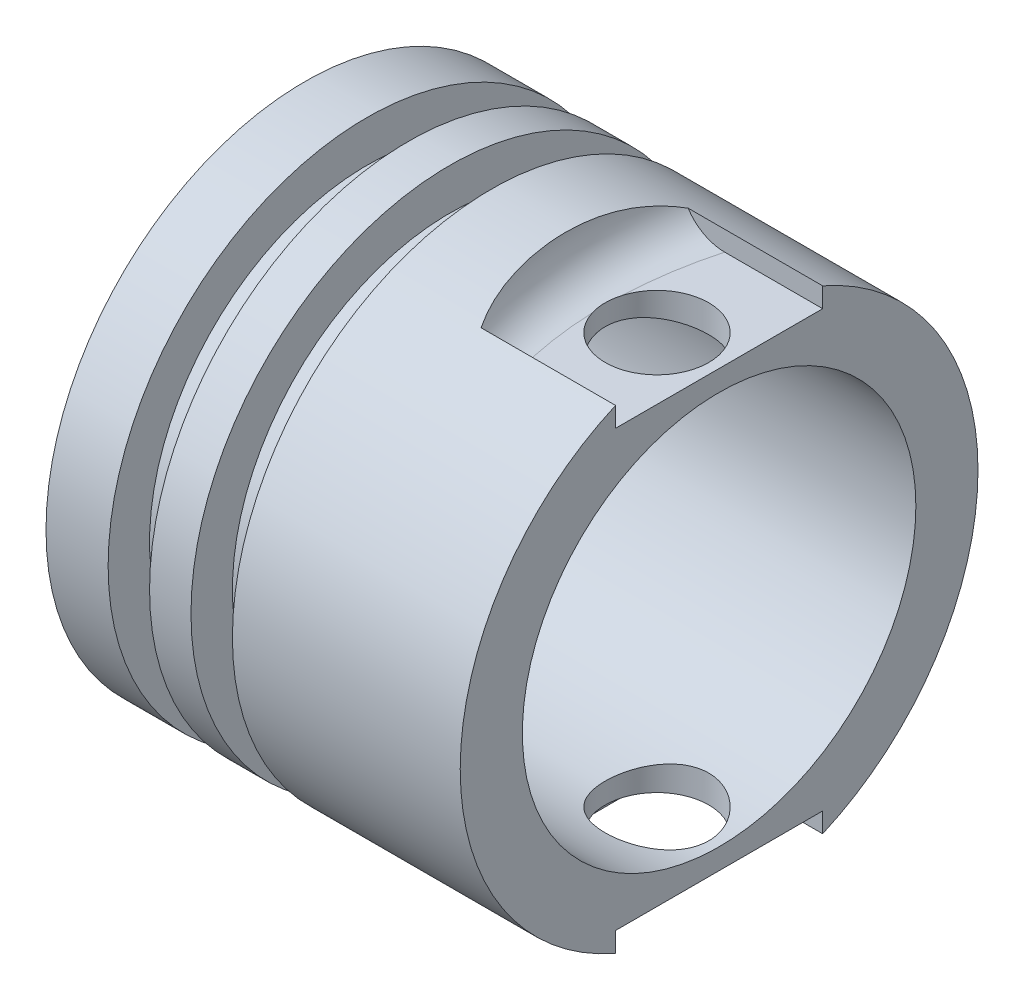
from build123d import *

# Parameters (mm, degrees)
CUT_EXTRUDE2_DEPTH = 2
FILLET1_R          = 2
CUT_EXTRUDE3_DEPTH = 2
FILLET2_R          = 2
SKETCH7_R          = 2.5
CUT_EXTRUDE4_DEPTH = 34.797190672


with BuildPart() as part:
    # Sketch1 → Revolve1 (revolve)
    with BuildSketch(Plane.XY, mode=Mode.PRIVATE) as revolve1_sk:
        Polygon((0, 0), (-1, 0), (-1, 12.5), (2, 12.5), (2, 10.5), (4, 10.5), (4, 12.5), (6, 12.5), (6, 10.5), (8, 10.5), (8, 12.5), (19, 12.5), (19, 9.5), (-0.010152284, 9.5), align=None)
    revolve(revolve1_sk.sketch.rotate(Axis((0, 0, 0), (-1, 0, 0)), 90), axis=Axis((0, 0, 0), (-1, 0, 0)))

    # Sketch4 → Cut-Extrude2 (cut)
    with BuildSketch(Plane(origin=(0, 12.5, 0), x_dir=(1, 0, 0), z_dir=(0, 1, 0))):
        with BuildLine():
            Line((21.034766018, -5), (21.034766018, 5))
            Line((21.034766018, 5), (12.203400087, 5))
            ThreePointArc((12.203400087, 5), (11.59564841, 0), (12.203400087, -5))
            Line((12.203400087, -5), (21.034766018, -5))
        make_face()
    extrude(amount=-CUT_EXTRUDE2_DEPTH, mode=Mode.SUBTRACT)

    # Fillet1
    # the kernel refuses this fillet: 2 mm, written as the material it adds along each edge
    with BuildSketch(Plane(origin=(32.467135125, 10.5, 0), x_dir=(-0.8863085047711677, 0, -0.46309527569421044), z_dir=(0.46309527569421044, 0, -0.8863085047711677))) as fillet1_piece_1_section:
        with BuildLine():
            CenterArc((20.871486715 - FILLET1_R, FILLET1_R), FILLET1_R, 270, 90)
            Line((20.871486715, FILLET1_R), (20.871486715, 0))
            Line((20.871486715, 0), (20.871486715 - FILLET1_R, 0))
        make_face()
    fillet1_piece_1 = revolve(axis=Axis((32.467135125, 10.5, 0), (0, 1, 0)), revolution_arc=55.174042112, mode=Mode.PRIVATE)
    fillet1_piece_1 = fillet1_piece_1 & Plane(origin=(12.25218062, 0, 0), x_dir=(0, 0, -1), z_dir=(1, 0, 0)) * Cylinder(12.5, 84, mode=Mode.PRIVATE)
    add(fillet1_piece_1)

    # Sketch6 → Cut-Extrude3 (cut)
    with BuildSketch(Plane(origin=(0, -12.5, 0), x_dir=(1, 0, 0), z_dir=(0, 1, 0))):
        with BuildLine():
            Line((19, -5), (12.506184944, -5))
            ThreePointArc((12.506184944, -5), (11.59564841, 0), (12.506184944, 5))
            Line((12.506184944, 5), (19, 5))
            Line((19, 5), (19, -5))
        make_face()
    extrude(amount=CUT_EXTRUDE3_DEPTH, mode=Mode.SUBTRACT)

    # Fillet2
    # the kernel refuses this fillet: 2 mm, written as the material it adds along each edge
    with BuildSketch(Plane(origin=(25.779086317, -10.5, 0), x_dir=(-0.7565204646440288, 0, 0.6539700196299391), z_dir=(0.6539700196299391, 0, 0.7565204646440288))) as fillet2_piece_1_section:
        with BuildLine():
            CenterArc((14.183437907 - FILLET2_R, FILLET2_R), FILLET2_R, 270, 90)
            Line((14.183437907, FILLET2_R), (14.183437907, 0))
            Line((14.183437907, 0), (14.183437907 - FILLET2_R, 0))
        make_face()
    fillet2_piece_1 = revolve(axis=Axis((25.779086317, -10.5, 0), (0, -1, 0)), revolution_arc=81.683194908, mode=Mode.PRIVATE)
    fillet2_piece_1 = fillet2_piece_1 & Plane(origin=(12.166922866, 0, 0), x_dir=(0, 0, -1), z_dir=(1, 0, 0)) * Cylinder(12.5, 57, mode=Mode.PRIVATE)
    add(fillet2_piece_1)

    # Sketch7 → Cut-Extrude4 (cut, through all)
    with BuildSketch(Plane(origin=(0, -12.5, 0), x_dir=(1, 0, 0), z_dir=(0, 1, 0))):
        with Locations(Location((16, 0, 0), (0, 0, 90))):
            Circle(SKETCH7_R)
    extrude(amount=CUT_EXTRUDE4_DEPTH, mode=Mode.SUBTRACT)


solid = part.part
